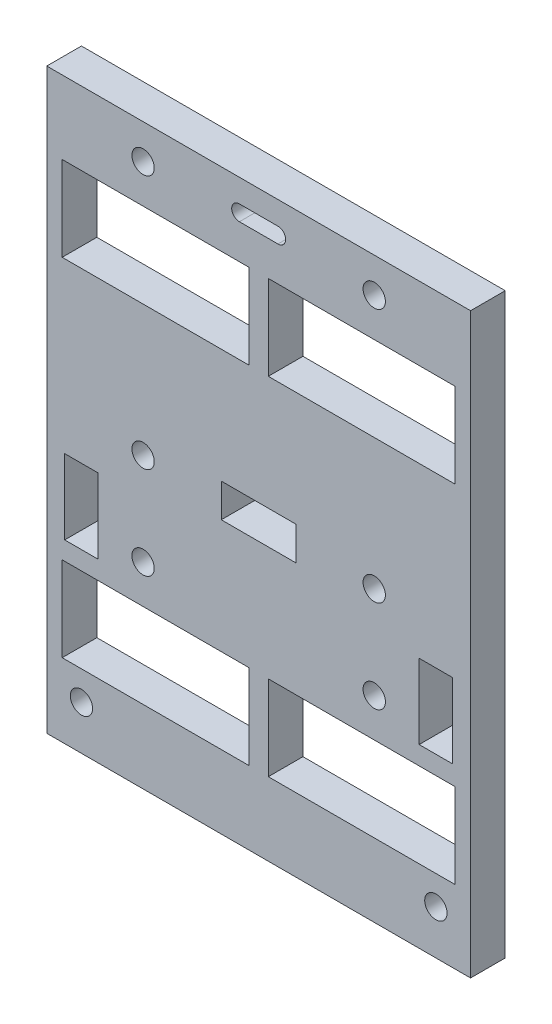
from build123d import *

# Parameters (mm, degrees)
SKETCH1_W                 = 55
SKETCH1_H                 = 75
SKETCH1_W_2               = 24.25
SKETCH1_H_2               = 11
BOSS_EXTRUDE1_DEPTH       = 4.5
SKETCH2_R                 = 1.45
SCREWHOLES_DEPTH          = 47.719910103
SKETCH4_W                 = 9.7
SKETCH4_H                 = 4.35
MOUNTINGPLATETAB_DEPTH    = 47.719910103
SKETCH5_R                 = 1.45
SKETCH5_W                 = 4.35
SKETCH5_H                 = 9.7
BRACETABS_DEPTH           = 47.719910103
SKETCH8_R                 = 1.45
EXPANSIONSCREWHOLES_DEPTH = 47.719910103
CABLETIESLOT_DEPTH        = 47.719910103


with BuildPart() as part:
    # Sketch1 → Boss-Extrude1 (new body)
    with BuildSketch(Plane.XY):
        Rectangle(SKETCH1_W, SKETCH1_H)
        with Locations((-13.375, 22.5)):
            Rectangle(SKETCH1_W_2, SKETCH1_H_2, mode=Mode.SUBTRACT)
        with Locations((13.375, 22.5)):
            Rectangle(SKETCH1_W_2, SKETCH1_H_2, mode=Mode.SUBTRACT)
        with Locations((13.375, -22.5)):
            Rectangle(SKETCH1_W_2, SKETCH1_H_2, mode=Mode.SUBTRACT)
        with Locations((-13.375, -22.5)):
            Rectangle(SKETCH1_W_2, SKETCH1_H_2, mode=Mode.SUBTRACT)
    extrude(amount=BOSS_EXTRUDE1_DEPTH)

    # Sketch2 → screwHoles (cut, through all)
    with BuildSketch(Plane.XY.offset(4.5)):
        with Locations((-15, 33)):
            Circle(SKETCH2_R)
        with Locations((15, 33)):
            Circle(SKETCH2_R)
        with Locations((15, 0)):
            Circle(SKETCH2_R)
        with Locations((-15, 0)):
            Circle(SKETCH2_R)
    extrude(amount=-SCREWHOLES_DEPTH, mode=Mode.SUBTRACT)

    # Sketch4 → mountingPlateTab (cut, through all)
    with BuildSketch(Plane.XY.offset(4.5)):
        Rectangle(SKETCH4_W, SKETCH4_H)
    extrude(amount=-MOUNTINGPLATETAB_DEPTH, mode=Mode.SUBTRACT)

    # Sketch5 → BraceTabs (cut, through all)
    with BuildSketch(Plane.XY.offset(4.5)):
        with Locations((23, -31.75)):
            Circle(SKETCH5_R)
        with Locations((-23, -31.75)):
            Circle(SKETCH5_R)
        with Locations((23, -9.75)):
            Rectangle(SKETCH5_W, SKETCH5_H)
        with Locations((-23, -9.75)):
            Rectangle(SKETCH5_W, SKETCH5_H)
    extrude(amount=-BRACETABS_DEPTH, mode=Mode.SUBTRACT)

    # Sketch8 → ExpansionScrewholes (cut, through all)
    with BuildSketch(Plane.XY.offset(4.5)):
        with Locations((-15, -12)):
            Circle(SKETCH8_R)
        with Locations((15, -12)):
            Circle(SKETCH8_R)
    extrude(amount=-EXPANSIONSCREWHOLES_DEPTH, mode=Mode.SUBTRACT)

    # Sketch12 → CableTieSlot (cut, through all)
    with BuildSketch(Plane.XY.offset(4.5)):
        with BuildLine():
            Line((-2.5, 34.5), (2.5, 34.5))
            ThreePointArc((2.5, 34.5), (3.5, 33.5), (2.5, 32.5))
            Line((2.5, 32.5), (-2.5, 32.5))
            ThreePointArc((-2.5, 32.5), (-3.5, 33.5), (-2.5, 34.5))
        make_face()
    extrude(amount=-CABLETIESLOT_DEPTH, mode=Mode.SUBTRACT)


solid = part.part
